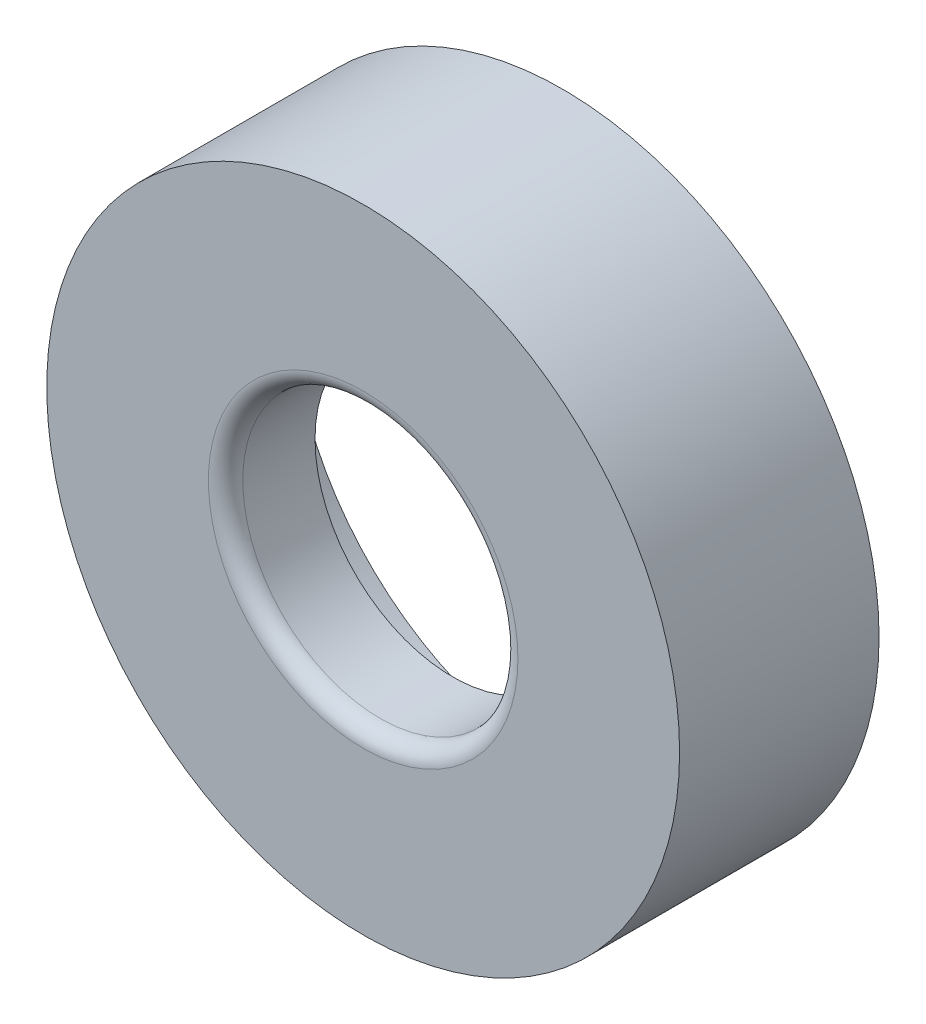
from build123d import *

# Parameters (mm, degrees)
SKETCH1_R           = 9.2
BOSS_EXTRUDE1_DEPTH = 5.8
SKETCH2_R           = 4
CUT_EXTRUDE1_DEPTH  = 96.217864219
SKETCH3_R           = 7.9
CUT_EXTRUDE2_DEPTH  = 3.2
FILLET1_R           = 0.5


with BuildPart() as part:
    # Sketch1 → Boss-Extrude1 (new body)
    with BuildSketch(Plane.XY):
        with Locations((85.206527413, -1.763997815)):
            Circle(SKETCH1_R)
    extrude(amount=BOSS_EXTRUDE1_DEPTH)

    # Sketch2 → Cut-Extrude1 (cut, through all)
    with BuildSketch(Plane.XY.offset(5.8)):
        with Locations((85.206527413, -1.763997815)):
            Circle(SKETCH2_R)
    extrude(amount=-CUT_EXTRUDE1_DEPTH, mode=Mode.SUBTRACT)

    # Sketch3 → Cut-Extrude2 (cut)
    with BuildSketch(Plane(origin=(0, 0, 0), x_dir=(-1, 0, 0), z_dir=(0, 0, -1))):
        with Locations((-85.206527413, -1.763997815)):
            Circle(SKETCH3_R)
    extrude(amount=-CUT_EXTRUDE2_DEPTH, mode=Mode.SUBTRACT)

    # Fillet1
    fillet1_edges = [part.edges().sort_by_distance(p)[0] for p in [
        (81.206527413, -1.763997815, 5.8),
    ]]
    fillet(fillet1_edges, radius=FILLET1_R)


solid = part.part
